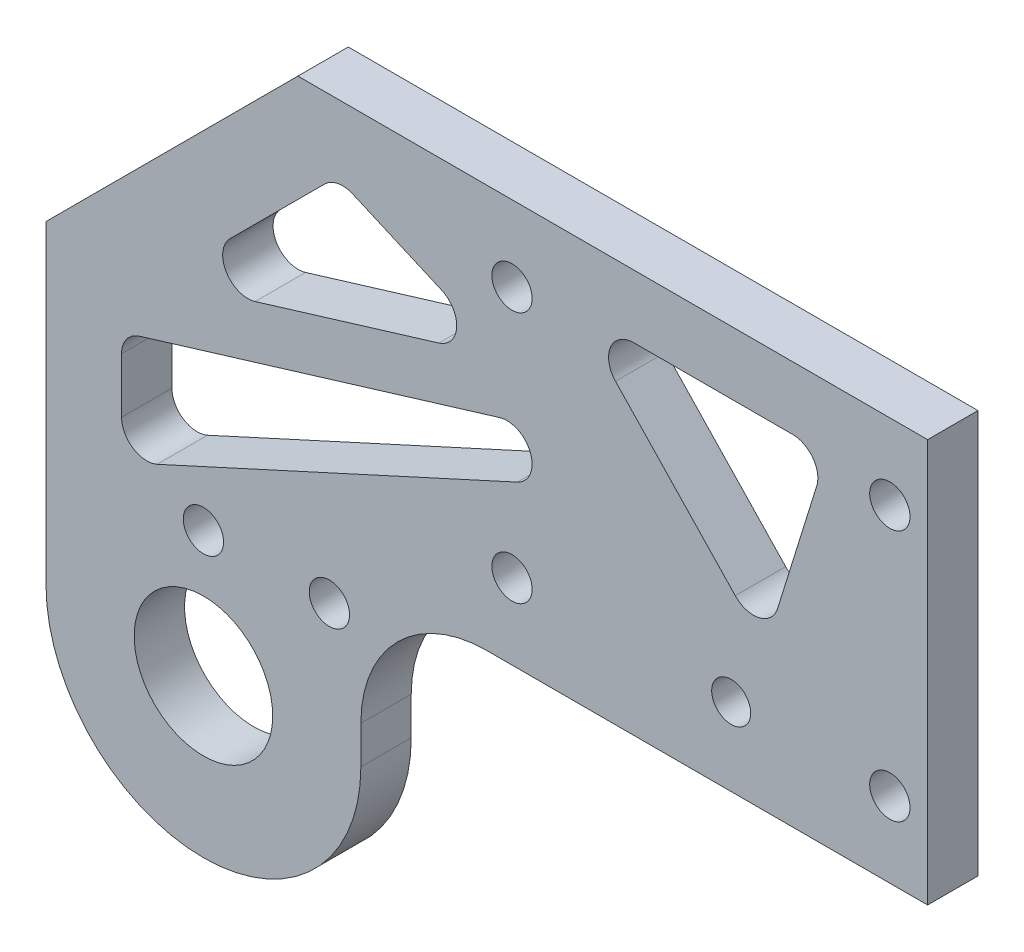
from build123d import *

# Parameters (mm, degrees)
SKETCH_1_R          = 1.6
SKETCH_1_R_2        = 6.075
EXTRUDE_1_DEPTH     = 4
CUT_EXTRUDE_1_REACH = 75.125
SKETCH_2_R          = 1.6
CUT_EXTRUDE_2_REACH = 75.125
SKETCH_3_R          = 1.6
CUT_EXTRUDE_3_REACH = 75.125
SKETCH_4_R          = 1.55
EXTRUDE_START       = -4
SKETCH_5_R          = 6.075
SKETCH_5_R_2        = 5.5
EXTRUDE_2_DEPTH     = 4
CHAMFER_1_SIZE      = 20
CUT_EXTRUDE_4_DEPTH = 10


with BuildPart() as part:
    # 草图1 → 凸台-拉伸1 (new body)
    with BuildSketch(Plane(origin=(0, 0, 0), x_dir=(-1, 0, 0), z_dir=(0, 0, -1))):
        with BuildLine():
            Line((12.5, 0), (12.5, 15))
            Line((12.5, 15), (12.5, 45))
            Line((12.5, 45), (-17.5, 45))
            Line((-17.5, 45), (-57.5, 45))
            Line((-57.5, 45), (-57.5, 13))
            Line((-57.5, 13), (-22.5, 13))
            ThreePointArc((-22.5, 13), (-15.428932188, 10.071067812), (-12.5, 3))
            Line((-12.5, 3), (-12.5, 0))
            ThreePointArc((-12.5, 0), (0, -12.5), (12.5, 0))
        make_face()
        with Locations((-54.5, 19)):
            Circle(SKETCH_1_R, mode=Mode.SUBTRACT)
        with Locations((-24.5, 19)):
            Circle(SKETCH_1_R, mode=Mode.SUBTRACT)
        with Locations((-24.5, 39)):
            Circle(SKETCH_1_R, mode=Mode.SUBTRACT)
        with Locations((-54.5, 39)):
            Circle(SKETCH_1_R, mode=Mode.SUBTRACT)
        Circle(SKETCH_1_R_2, mode=Mode.SUBTRACT)
    extrude(amount=-EXTRUDE_1_DEPTH)

    # 草图2 → 切除-拉伸1 (cut, up to next)
    with BuildSketch(Plane(origin=(0, 0, 0), x_dir=(-1, 0, 0), z_dir=(0, 0, -1)), mode=Mode.PRIVATE) as cut_extrude_1_sk1:
        with Locations((0, 10)):
            Circle(SKETCH_2_R)
    cut_extrude_1_tool1 = extrude(cut_extrude_1_sk1.sketch, amount=-CUT_EXTRUDE_1_REACH, mode=Mode.PRIVATE) & part.part
    add(cut_extrude_1_tool1.solids().sort_by_distance((0, 10, 0))[0], mode=Mode.SUBTRACT)

    # 草图3 → 切除-拉伸2 (cut, up to next)
    with BuildSketch(Plane.XY.offset(4), mode=Mode.PRIVATE) as cut_extrude_2_sk1:
        with Locations((10, 10)):
            Circle(SKETCH_3_R)
    cut_extrude_2_tool1 = extrude(cut_extrude_2_sk1.sketch, amount=-CUT_EXTRUDE_2_REACH, mode=Mode.PRIVATE) & part.part
    add(cut_extrude_2_tool1.solids().sort_by_distance((10, 10, 4))[0], mode=Mode.SUBTRACT)

    # 草图4 → 切除-拉伸3 (cut, up to next)
    with BuildSketch(Plane.XY.offset(4), mode=Mode.PRIVATE) as cut_extrude_3_sk1:
        with Locations((41.903612375, 19.168270074)):
            Circle(SKETCH_4_R)
    cut_extrude_3_tool1 = extrude(cut_extrude_3_sk1.sketch, amount=-CUT_EXTRUDE_3_REACH, mode=Mode.PRIVATE) & part.part
    add(cut_extrude_3_tool1.solids().sort_by_distance((41.903612, 19.16827, 4))[0], mode=Mode.SUBTRACT)

    # 草图5 → 凸台-拉伸2 (add)
    with BuildSketch(Plane.XY.offset(4).offset(EXTRUDE_START)):
        Circle(SKETCH_5_R)
        Circle(SKETCH_5_R_2, mode=Mode.SUBTRACT)
    extrude(amount=EXTRUDE_2_DEPTH)

    # 倒角1
    chamfer_1_edges = [part.edges().sort_by_distance(p)[0] for p in [
        (-12.5, 45, 2),
    ]]
    chamfer(chamfer_1_edges, length=CHAMFER_1_SIZE)

    # 草图6 → 切除-拉伸4 (cut)
    with BuildSketch(Plane.XY.offset(4)):
        with BuildLine():
            Line((9.634482471, 38.649201097), (2.113604897, 31.128323523))
            ThreePointArc((2.113604897, 31.128323523), (1.812829409, 28.685123781), (4.110129794, 27.800758579))
            Line((4.110129794, 27.800758579), (18.692042435, 32.238632926))
            ThreePointArc((18.692042435, 32.238632926), (20.106354196, 34.035811099), (18.910017796, 35.984889435))
            Line((18.910017796, 35.984889435), (11.848982729, 39.067892662))
            ThreePointArc((11.848982729, 39.067892662), (10.677142261, 39.200171443), (9.634482471, 38.649201097))
        make_face()
        with BuildLine():
            Line((32.71747005, 36.620860129), (42.227284145, 26.633201667))
            ThreePointArc((42.227284145, 26.633201667), (44.130956278, 26.064840044), (45.58542604, 27.418176749))
            Line((45.58542604, 27.418176749), (48.692879305, 37.405835211))
            ThreePointArc((48.692879305, 37.405835211), (48.393816721, 39.185679219), (46.783175609, 40))
            Line((46.783175609, 40), (34.165908249, 40))
            ThreePointArc((34.165908249, 40), (32.327664557, 38.787946781), (32.71747005, 36.620860129))
        make_face()
        with BuildLine():
            Line((-6.5, 18.908624945), (-6.5, 14.540152244))
            ThreePointArc((-6.5, 14.540152244), (-5.580990037, 12.857457816), (-3.668539461, 12.721176331))
            Line((-3.668539461, 12.721176331), (24.927936602, 25.79273008))
            ThreePointArc((24.927936602, 25.79273008), (25.966793038, 28.320165173), (23.514164728, 29.525057374))
            Line((23.514164728, 29.525057374), (-5.082311335, 20.821976327))
            ThreePointArc((-5.082311335, 20.821976327), (-6.106957166, 20.099292264), (-6.5, 18.908624945))
        make_face()
    extrude(amount=-CUT_EXTRUDE_4_DEPTH, mode=Mode.SUBTRACT)


solid = part.part
